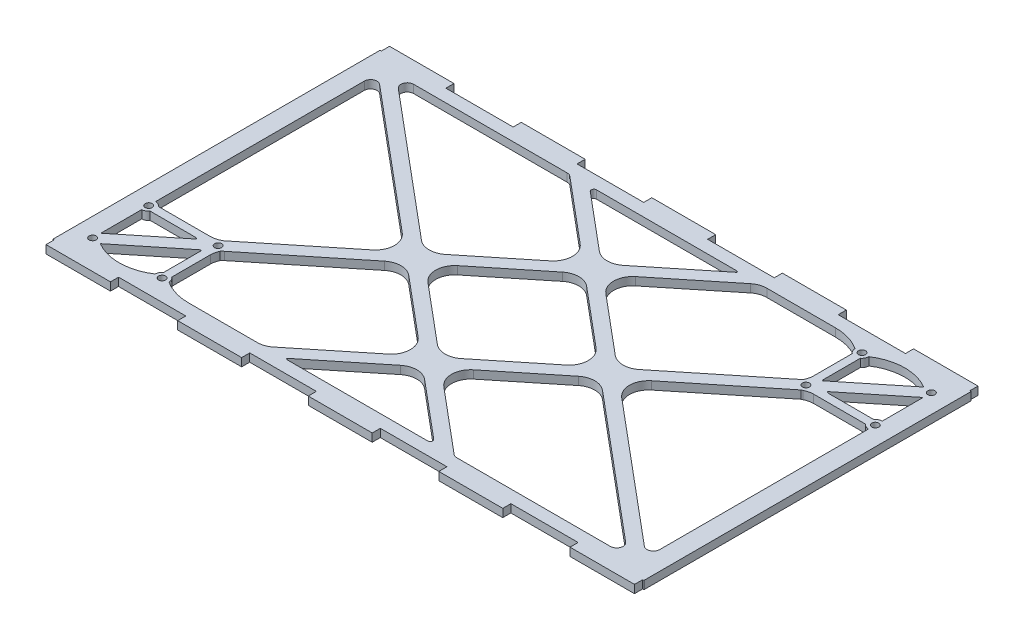
from build123d import *

# Parameters (mm, degrees)
SKETCH1_W           = 464.02
SKETCH1_H           = 269.7
BOSS_EXTRUDE1_DEPTH = 6.35
SKETCH2_R           = 2.75
CUT_EXTRUDE1_DEPTH  = 6.35
CUT_EXTRUDE2_DEPTH  = 6.35
SKETCH5_W           = 1
SKETCH5_H           = 6.36
SKETCH5_W_2         = 52.8
SKETCH5_W_3         = 52.31
CUT_EXTRUDE3_DEPTH  = 10
SKETCH7_R           = 2.75
BOSS_EXTRUDE2_DEPTH = 6.35
FILLET3_DEPTH       = 6.35


with BuildPart() as part:
    # Sketch1 → Boss-Extrude1 (new body)
    with BuildSketch(Plane(origin=(0, 0, 0), x_dir=(1, 0, 0), z_dir=(0, 1, 0))):
        Rectangle(SKETCH1_W, SKETCH1_H)
    extrude(amount=BOSS_EXTRUDE1_DEPTH)

    # Sketch2 → Cut-Extrude1 (cut)
    with BuildSketch(Plane.XZ):
        with Locations(Location((-217.25, 112, 0), (0, 0, 270))):
            Circle(SKETCH2_R)
        with Locations(Location((-162.75, 112, 0), (0, 0, 270))):
            Circle(SKETCH2_R)
        with Locations(Location((-162.75, 68, 0), (0, 0, 270))):
            Circle(SKETCH2_R)
        with Locations(Location((-217.25, 68, 0), (0, 0, 270))):
            Circle(SKETCH2_R)
        with Locations(Location((217.25, -112, 0), (0, 0, 270))):
            Circle(SKETCH2_R)
        with Locations(Location((162.75, -112, 0), (0, 0, 270))):
            Circle(SKETCH2_R)
        with Locations(Location((162.75, -68, 0), (0, 0, 270))):
            Circle(SKETCH2_R)
        with Locations(Location((217.25, -68, 0), (0, 0, 270))):
            Circle(SKETCH2_R)
    extrude(amount=-CUT_EXTRUDE1_DEPTH, mode=Mode.SUBTRACT)

    # Sketch3 → Cut-Extrude2 (cut)
    with BuildSketch(Plane.XZ):
        with BuildLine():
            Line((-97.587389001, -11.684607619), (-209.038267705, -105.093705424))
            ThreePointArc((-209.038267705, -105.093705424), (-214.36439572, -105.792563893), (-217.25, -101.261633443))
            Line((-217.25, -101.261633443), (-217.25, 62.575))
            ThreePointArc((-217.25, 62.575), (-214.779549636, 63.17014493), (-212.85113651, 64.825))
            Line((-212.85113651, 64.825), (-167.14886349, 64.825))
            ThreePointArc((-167.14886349, 64.825), (-164.557122119, 62.884832882), (-161.321795409, 62.766372516))
            Line((-161.321795409, 62.766372516), (-97.80002183, 11.482738801))
            ThreePointArc((-97.80002183, 11.482738801), (-92.223217631, -0.050725582), (-97.587389001, -11.684607619))
        make_face()
        with BuildLine():
            ThreePointArc((-165.925, 78.829008315), (-167.062643852, 77.024474615), (-169.181341874, 77.272857585))
            Line((-169.181341874, 77.272857585), (-211.744216533, 111.635545383))
            ThreePointArc((-211.744216533, 111.635545383), (-211.82787845, 111.822366659), (-211.726153813, 112))
            ThreePointArc((-211.726153813, 112), (-189.950576907, 118.5), (-168.175, 112))
            ThreePointArc((-168.175, 112), (-167.57985507, 109.529549636), (-165.925, 107.60113651))
            Line((-165.925, 107.60113651), (-165.925, 78.829008315))
        make_face()
        with BuildLine():
            ThreePointArc((-69.195399046, 12.111258303), (-78.692929836, 8.60810599), (-88.253159987, 11.936343767))
            Line((-88.253159987, 11.936343767), (-157.332909959, 67.707151084))
            ThreePointArc((-157.332909959, 67.707151084), (-157.855202339, 70.339141051), (-159.575, 72.39886349))
            Line((-159.575, 72.39886349), (-159.575, 107.60113651))
            ThreePointArc((-159.575, 107.60113651), (-157.92014493, 109.529549636), (-157.325, 112))
            ThreePointArc((-157.325, 112), (-146.911924464, 116.840330407), (-135.549423093, 118.5))
            Line((-135.549423093, 118.5), (-75.076473615, 118.5))
            ThreePointArc((-75.076473615, 118.5), (-73.410923275, 118.21443974), (-71.93561893, 117.390376826))
            Line((-71.93561893, 117.390376826), (-20.746121324, 76.063076007))
            ThreePointArc((-20.746121324, 76.063076007), (-15.169317125, 64.529611624), (-20.533488495, 52.895729587))
            Line((-20.533488495, 52.895729587), (-69.195399046, 12.111258303))
        make_face()
        with BuildLine():
            ThreePointArc((-85.139517992, -14.299582162), (-75.641987202, -10.796429849), (-66.081757051, -14.124667626))
            Line((-66.081757051, -14.124667626), (-20.519005299, -50.909274546))
            ThreePointArc((-20.519005299, -50.909274546), (-14.942201099, -62.442738929), (-20.306372469, -74.076620966))
            Line((-20.306372469, -74.076620966), (-71.916527557, -117.332071981))
            ThreePointArc((-71.916527557, -117.332071981), (-73.419511758, -118.198955198), (-75.128259852, -118.5))
            Line((-75.128259852, -118.5), (-195.716337306, -118.5))
            ThreePointArc((-195.716337306, -118.5), (-200.415292504, -115.208748094), (-198.928069601, -109.667928019))
            Line((-198.928069601, -109.667928019), (-85.139517992, -14.299582162))
        make_face()
        with BuildLine():
            ThreePointArc((-56.534895208, -13.67106266), (-62.111699407, -2.137598277), (-56.747528037, 9.49628376))
            Line((-56.747528037, 9.49628376), (-8.085617485, 50.280755044))
            ThreePointArc((-8.085617485, 50.280755044), (1.411913304, 53.783907357), (10.972143455, 50.45566958))
            Line((10.972143455, 50.45566958), (56.534895208, 13.67106266))
            ThreePointArc((56.534895208, 13.67106266), (62.111699407, 2.137598277), (56.747528037, -9.49628376))
            Line((56.747528037, -9.49628376), (8.085617485, -50.280755044))
            ThreePointArc((8.085617485, -50.280755044), (-1.411913304, -53.783907357), (-10.972143455, -50.45566958))
            Line((-10.972143455, -50.45566958), (-56.534895208, -13.67106266))
        make_face()
        with BuildLine():
            ThreePointArc((-52.242235331, -118.5), (-54.12181741, -117.183499238), (-53.526928249, -114.967171208))
            Line((-53.526928249, -114.967171208), (-7.85850146, -76.691595509))
            ThreePointArc((-7.85850146, -76.691595509), (1.63902933, -73.188443196), (11.199259481, -76.516680973))
            Line((11.199259481, -76.516680973), (58.796547484, -114.94384927))
            ThreePointArc((58.796547484, -114.94384927), (59.425981506, -117.166220136), (57.54020561, -118.5))
            Line((57.54020561, -118.5), (-52.242235331, -118.5))
        make_face()
        with BuildLine():
            Line((20.533488495, -52.895729587), (69.195399046, -12.111258303))
            ThreePointArc((69.195399046, -12.111258303), (78.692929836, -8.60810599), (88.253159987, -11.936343767))
            Line((88.253159987, -11.936343767), (157.332909959, -67.707151084))
            ThreePointArc((157.332909959, -67.707151084), (157.855202339, -70.339141051), (159.575, -72.39886349))
            Line((159.575, -72.39886349), (159.575, -107.60113651))
            ThreePointArc((159.575, -107.60113651), (157.92014493, -109.529549636), (157.325, -112))
            ThreePointArc((157.325, -112), (146.911924464, -116.840330407), (135.549423093, -118.5))
            Line((135.549423093, -118.5), (73.310038543, -118.5))
            Line((73.310038543, -118.5), (20.746121324, -76.063076007))
            ThreePointArc((20.746121324, -76.063076007), (15.169317125, -64.529611624), (20.533488495, -52.895729587))
        make_face()
        with BuildLine():
            ThreePointArc((85.139517992, 14.299582162), (75.641987202, 10.796429849), (66.081757051, 14.124667626))
            Line((66.081757051, 14.124667626), (20.519005299, 50.909274546))
            ThreePointArc((20.519005299, 50.909274546), (14.942201099, 62.442738929), (20.306372469, 74.076620966))
            Line((20.306372469, 74.076620966), (71.916527557, 117.332071981))
            ThreePointArc((71.916527557, 117.332071981), (73.419511758, 118.198955198), (75.128259852, 118.5))
            Line((75.128259852, 118.5), (195.716337306, 118.5))
            ThreePointArc((195.716337306, 118.5), (200.415292504, 115.208748094), (198.928069601, 109.667928019))
            Line((198.928069601, 109.667928019), (85.139517992, 14.299582162))
        make_face()
        with BuildLine():
            Line((52.242235331, 118.5), (-57.54020561, 118.5))
            ThreePointArc((-57.54020561, 118.5), (-59.425981506, 117.166220136), (-58.796547484, 114.94384927))
            Line((-58.796547484, 114.94384927), (-11.199259481, 76.516680973))
            ThreePointArc((-11.199259481, 76.516680973), (-1.63902933, 73.188443196), (7.85850146, 76.691595509))
            Line((7.85850146, 76.691595509), (53.526928249, 114.967171208))
            ThreePointArc((53.526928249, 114.967171208), (54.12181741, 117.183499238), (52.242235331, 118.5))
        make_face()
        with BuildLine():
            ThreePointArc((97.80002183, -11.482738801), (92.223217631, 0.050725582), (97.587389001, 11.684607619))
            Line((97.587389001, 11.684607619), (209.038267705, 105.093705424))
            ThreePointArc((209.038267705, 105.093705424), (214.36439572, 105.792563893), (217.25, 101.261633443))
            Line((217.25, 101.261633443), (217.25, -62.575))
            ThreePointArc((217.25, -62.575), (214.779549636, -63.17014493), (212.85113651, -64.825))
            Line((212.85113651, -64.825), (167.14886349, -64.825))
            ThreePointArc((167.14886349, -64.825), (164.557122119, -62.884832882), (161.321795409, -62.766372516))
            Line((161.321795409, -62.766372516), (97.80002183, -11.482738801))
        make_face()
        with BuildLine():
            Line((212.85113651, -71.175), (177.398146663, -71.175))
            ThreePointArc((177.398146663, -71.175), (175.512370767, -72.508779864), (176.141804789, -74.73115073))
            Line((176.141804789, -74.73115073), (215.394975362, -106.421783854))
            ThreePointArc((215.394975362, -106.421783854), (216.60192389, -106.563278987), (217.25, -105.53529894))
            Line((217.25, -105.53529894), (217.25, -73.425))
            ThreePointArc((217.25, -73.425), (214.779549636, -72.82985507), (212.85113651, -71.175))
        make_face()
        with BuildLine():
            ThreePointArc((165.925, -78.829008315), (167.062643852, -77.024474615), (169.181341874, -77.272857585))
            Line((169.181341874, -77.272857585), (211.744216533, -111.635545383))
            ThreePointArc((211.744216533, -111.635545383), (211.82787845, -111.822366659), (211.726153813, -112))
            ThreePointArc((211.726153813, -112), (189.950576907, -118.5), (168.175, -112))
            ThreePointArc((168.175, -112), (167.57985507, -109.529549636), (165.925, -107.60113651))
            Line((165.925, -107.60113651), (165.925, -78.829008315))
        make_face()
        with BuildLine():
            Line((-176.141804789, 74.73115073), (-215.394975362, 106.421783854))
            ThreePointArc((-215.394975362, 106.421783854), (-216.60192389, 106.563278987), (-217.25, 105.53529894))
            Line((-217.25, 105.53529894), (-217.25, 73.425))
            ThreePointArc((-217.25, 73.425), (-214.779549636, 72.82985507), (-212.85113651, 71.175))
            Line((-212.85113651, 71.175), (-177.398146663, 71.175))
            ThreePointArc((-177.398146663, 71.175), (-175.512370767, 72.508779864), (-176.141804789, 74.73115073))
        make_face()
    extrude(amount=-CUT_EXTRUDE2_DEPTH, mode=Mode.SUBTRACT)

    # Sketch5 → Cut-Extrude3 (cut)
    with BuildSketch(Plane.XZ):
        with Locations((-231.51, -131.67)):
            Rectangle(SKETCH5_W, SKETCH5_H)
        with Locations((-154.01, -131.67)):
            Rectangle(SKETCH5_W_2, SKETCH5_H)
        with Locations((-51.255, -131.67)):
            Rectangle(SKETCH5_W_3, SKETCH5_H)
        with Locations((51.255, -131.67)):
            Rectangle(SKETCH5_W_3, SKETCH5_H)
        with Locations((154.01, -131.67)):
            Rectangle(SKETCH5_W_2, SKETCH5_H)
        with Locations((231.51, -131.67)):
            Rectangle(SKETCH5_W, SKETCH5_H)
    cut_extrude3 = extrude(amount=-CUT_EXTRUDE3_DEPTH, mode=Mode.SUBTRACT)

    # Mirror1: Cut-Extrude3 across plane
    add(cut_extrude3.mirror(Plane.XY), mode=Mode.SUBTRACT)

    # Sketch7 → Boss-Extrude2 (add)
    # profile 1 of 2: a face of its own
    with BuildSketch(Plane.XZ):
        with BuildLine():
            Line((-175.738034604, 72.05963999), (-77.108038552, -7.568246732))
            Line((-77.108038552, -7.568246732), (0.17297798, -69.960260079))
            Line((0.17297798, -69.960260079), (60.296064928, -118.5))
            Line((60.296064928, -118.5), (76.215298708, -118.5))
            Line((76.215298708, -118.5), (7.98370424, -63.413942081))
            Line((7.98370424, -63.413942081), (-69.297312292, -1.021928734))
            Line((-69.297312292, -1.021928734), (-166.484747769, 77.441321927))
            Line((-166.484747769, 77.441321927), (-210.354813882, 112.859356954))
            ThreePointArc((-210.354813882, 112.859356954), (-215.017261044, 110.366396329), (-217.25, 105.573887282))
            Line((-217.25, 105.573887282), (-175.738034604, 72.05963999))
        make_face()
        with Locations(Location((-162.75, 68, 0), (0, 0, 270))):
            Circle(SKETCH7_R, mode=Mode.SUBTRACT)
    # profile 2 of 2: a face of its own
    with BuildSketch(Plane.XZ):
        with BuildLine():
            Line((175.738034604, -72.05963999), (77.108038552, 7.568246732))
            Line((77.108038552, 7.568246732), (-0.17297798, 69.960260079))
            Line((-0.17297798, 69.960260079), (-60.296064928, 118.5))
            Line((-60.296064928, 118.5), (-76.215298708, 118.5))
            Line((-76.215298708, 118.5), (-7.98370424, 63.413942081))
            Line((-7.98370424, 63.413942081), (69.297312292, 1.021928734))
            Line((69.297312292, 1.021928734), (166.484747769, -77.441321927))
            Line((166.484747769, -77.441321927), (210.354813882, -112.859356954))
            ThreePointArc((210.354813882, -112.859356954), (215.017261044, -110.366396329), (217.25, -105.573887282))
            Line((217.25, -105.573887282), (175.738034604, -72.05963999))
        make_face()
        with Locations(Location((162.75, -68, 0), (0, 0, 270))):
            Circle(SKETCH7_R, mode=Mode.SUBTRACT)
    extrude(amount=-BOSS_EXTRUDE2_DEPTH)

    # Fillet3: read off the stored shape, not the designer's step
    # Fillet3 outline → Fillet3 (add)
    with BuildSketch(Plane(origin=(0, 0, 0), x_dir=(1, 0, 0), z_dir=(0, 1, 0))):
        with BuildLine():
            Line((-76.215298708, -118.5), (-72.092039868, -115.171130478))
            ThreePointArc((-72.092039868, -115.171130478), (-76.517952903, -117.643319221), (-81.514603923, -118.5))
            Line((-81.514603923, -118.5), (-76.215298708, -118.5))
        make_face()
        with BuildLine():
            ThreePointArc((-158.178272267, -70.998655692), (-157.316608127, -70.105503813), (-156.384060469, -69.286638602))
            Line((-156.384060469, -69.286638602), (-157.971370599, -70.568136688))
            ThreePointArc((-157.971370599, -70.568136688), (-158.669197957, -71.574588044), (-159.575, -72.39886349))
            Line((-159.575, -72.39886349), (-159.575, -77.31933474))
            ThreePointArc((-159.575, -77.31933474), (-159.221656342, -74.08275352), (-158.178272267, -70.998655692))
        make_face()
        with BuildLine():
            ThreePointArc((-86.827702444, -13.131046802), (-77.267472294, -9.802809025), (-67.769941504, -13.305961337))
            Line((-67.769941504, -13.305961337), (-69.195399046, -12.111258303))
            ThreePointArc((-69.195399046, -12.111258303), (-74.997676546, -9.105449249), (-81.527379323, -8.851886851))
            Line((-81.527379323, -8.851886851), (-86.827702444, -13.131046802))
        make_face()
        with BuildLine():
            ThreePointArc((-21.958946037, -51.701026552), (-16.594774667, -63.334908589), (-22.171578867, -74.868372972))
            Line((-22.171578867, -74.868372972), (-16.313164581, -70.138644008))
            ThreePointArc((-16.313164581, -70.138644008), (-15.598751311, -60.825852254), (-20.533488495, -52.895729587))
            Line((-20.533488495, -52.895729587), (-21.958946037, -51.701026552))
        make_face()
        with BuildLine():
            ThreePointArc((-9.773801938, -77.711384008), (-0.213571788, -74.383146231), (9.283959002, -77.886298543))
            Line((9.283959002, -77.886298543), (7.85850146, -76.691595509))
            ThreePointArc((7.85850146, -76.691595509), (2.05622396, -73.685786455), (-4.473478817, -73.432224057))
            Line((-4.473478817, -73.432224057), (-9.773801938, -77.711384008))
        make_face()
        with BuildLine():
            ThreePointArc((9.546685912, -49.260966545), (-0.013544238, -52.589204322), (-9.511075028, -49.086052009))
            Line((-9.511075028, -49.086052009), (-8.085617485, -50.280755044))
            ThreePointArc((-8.085617485, -50.280755044), (-2.283339986, -53.286564098), (4.246362791, -53.540126496))
            Line((4.246362791, -53.540126496), (9.546685912, -49.260966545))
        make_face()
        with BuildLine():
            Line((-56.747528037, -9.49628376), (-55.322070495, -10.690986794))
            ThreePointArc((-55.322070495, -10.690986794), (-60.686241865, 0.942895243), (-55.109437665, 12.476359625))
            Line((-55.109437665, 12.476359625), (-60.967851951, 7.746630661))
            ThreePointArc((-60.967851951, 7.746630661), (-61.682265221, -1.566161093), (-56.747528037, -9.49628376))
        make_face()
        with BuildLine():
            ThreePointArc((55.322070495, 10.690986794), (60.686241865, -0.942895243), (55.109437665, -12.476359625))
            Line((55.109437665, -12.476359625), (60.967851951, -7.746630661))
            ThreePointArc((60.967851951, -7.746630661), (61.682265221, 1.566161093), (56.747528037, 9.49628376))
            Line((56.747528037, 9.49628376), (55.322070495, 10.690986794))
        make_face()
        with BuildLine():
            Line((-4.246362791, 53.540126496), (-9.546685912, 49.260966545))
            ThreePointArc((-9.546685912, 49.260966545), (0.013544238, 52.589204322), (9.511075028, 49.086052009))
            Line((9.511075028, 49.086052009), (8.085617485, 50.280755044))
            ThreePointArc((8.085617485, 50.280755044), (2.283339986, 53.286564098), (-4.246362791, 53.540126496))
        make_face()
        with BuildLine():
            Line((20.306372469, -74.076620966), (21.731830011, -75.271324))
            ThreePointArc((21.731830011, -75.271324), (16.367658641, -63.637441963), (21.944462841, -52.103977581))
            Line((21.944462841, -52.103977581), (16.086048555, -56.833706545))
            ThreePointArc((16.086048555, -56.833706545), (15.371635286, -66.146498299), (20.306372469, -74.076620966))
        make_face()
        with BuildLine():
            Line((72.807537715, -11.04021071), (67.507214594, -15.319370661))
            ThreePointArc((67.507214594, -15.319370661), (77.067444744, -11.991132884), (86.564975534, -15.494285197))
            Line((86.564975534, -15.494285197), (85.139517992, -14.299582162))
            ThreePointArc((85.139517992, -14.299582162), (79.337240492, -11.293773108), (72.807537715, -11.04021071))
        make_face()
        with BuildLine():
            ThreePointArc((167.14886349, 64.825), (166.284971504, 63.884832753), (165.22527006, 63.172613219))
            ThreePointArc((165.22527006, 63.172613219), (168.548979523, 64.406052745), (172.06933474, 64.825))
            Line((172.06933474, 64.825), (167.14886349, 64.825))
        make_face()
        with BuildLine():
            ThreePointArc((99.012846543, -12.879310654), (93.648675173, -1.245428617), (99.225479373, 10.288035766))
            Line((99.225479373, 10.288035766), (93.367065087, 5.558306801))
            ThreePointArc((93.367065087, 5.558306801), (92.652651818, -3.754484953), (97.587389001, -11.684607619))
            Line((97.587389001, -11.684607619), (99.012846543, -12.879310654))
        make_face()
        with BuildLine():
            ThreePointArc((159.575, 77.31933474), (159.221656342, 74.08275352), (158.178272267, 70.998655692))
            ThreePointArc((158.178272267, 70.998655692), (157.316608127, 70.105503813), (156.384060469, 69.286638602))
            Line((156.384060469, 69.286638602), (157.971370599, 70.568136688))
            ThreePointArc((157.971370599, 70.568136688), (158.669197957, 71.574588044), (159.575, 72.39886349))
            Line((159.575, 72.39886349), (159.575, 77.31933474))
        make_face()
        with BuildLine():
            Line((76.215298708, 118.5), (72.092039868, 115.171130478))
            ThreePointArc((72.092039868, 115.171130478), (76.517952903, 117.643319221), (81.514603923, 118.5))
            Line((81.514603923, 118.5), (76.215298708, 118.5))
        make_face()
        with BuildLine():
            Line((20.533488495, 52.895729587), (21.958946037, 51.701026552))
            ThreePointArc((21.958946037, 51.701026552), (16.594774667, 63.334908589), (22.171578867, 74.868372972))
            Line((22.171578867, 74.868372972), (16.313164581, 70.138644008))
            ThreePointArc((16.313164581, 70.138644008), (15.598751311, 60.825852254), (20.533488495, 52.895729587))
        make_face()
        with BuildLine():
            Line((81.527379323, 8.851886851), (86.827702444, 13.131046802))
            ThreePointArc((86.827702444, 13.131046802), (77.267472294, 9.802809025), (67.769941504, 13.305961337))
            Line((67.769941504, 13.305961337), (69.195399046, 12.111258303))
            ThreePointArc((69.195399046, 12.111258303), (74.997676546, 9.105449249), (81.527379323, 8.851886851))
        make_face()
        with BuildLine():
            ThreePointArc((-167.14886349, -64.825), (-166.284971504, -63.884832753), (-165.22527006, -63.172613219))
            ThreePointArc((-165.22527006, -63.172613219), (-168.548979523, -64.406052745), (-172.06933474, -64.825))
            Line((-172.06933474, -64.825), (-167.14886349, -64.825))
        make_face()
        with BuildLine():
            ThreePointArc((-99.012846543, 12.879310654), (-93.648675173, 1.245428617), (-99.225479373, -10.288035766))
            Line((-99.225479373, -10.288035766), (-93.367065087, -5.558306801))
            ThreePointArc((-93.367065087, -5.558306801), (-92.652651818, 3.754484953), (-97.587389001, 11.684607619))
            Line((-97.587389001, 11.684607619), (-99.012846543, 12.879310654))
        make_face()
        with BuildLine():
            Line((-72.807537715, 11.04021071), (-67.507214594, 15.319370661))
            ThreePointArc((-67.507214594, 15.319370661), (-77.067444744, 11.991132884), (-86.564975534, 15.494285197))
            Line((-86.564975534, 15.494285197), (-85.139517992, 14.299582162))
            ThreePointArc((-85.139517992, 14.299582162), (-79.337240492, 11.293773108), (-72.807537715, 11.04021071))
        make_face()
        with BuildLine():
            ThreePointArc((-21.731830011, 75.271324), (-16.367658641, 63.637441963), (-21.944462841, 52.103977581))
            Line((-21.944462841, 52.103977581), (-16.086048555, 56.833706545))
            ThreePointArc((-16.086048555, 56.833706545), (-15.371635286, 66.146498299), (-20.306372469, 74.076620966))
            Line((-20.306372469, 74.076620966), (-21.731830011, 75.271324))
        make_face()
        with BuildLine():
            ThreePointArc((9.773801938, 77.711384008), (0.213571788, 74.383146231), (-9.283959002, 77.886298543))
            Line((-9.283959002, 77.886298543), (-7.85850146, 76.691595509))
            ThreePointArc((-7.85850146, 76.691595509), (-2.05622396, 73.685786455), (4.473478817, 73.432224057))
            Line((4.473478817, 73.432224057), (9.773801938, 77.711384008))
        make_face()
    extrude(amount=FILLET3_DEPTH)


solid = part.part
